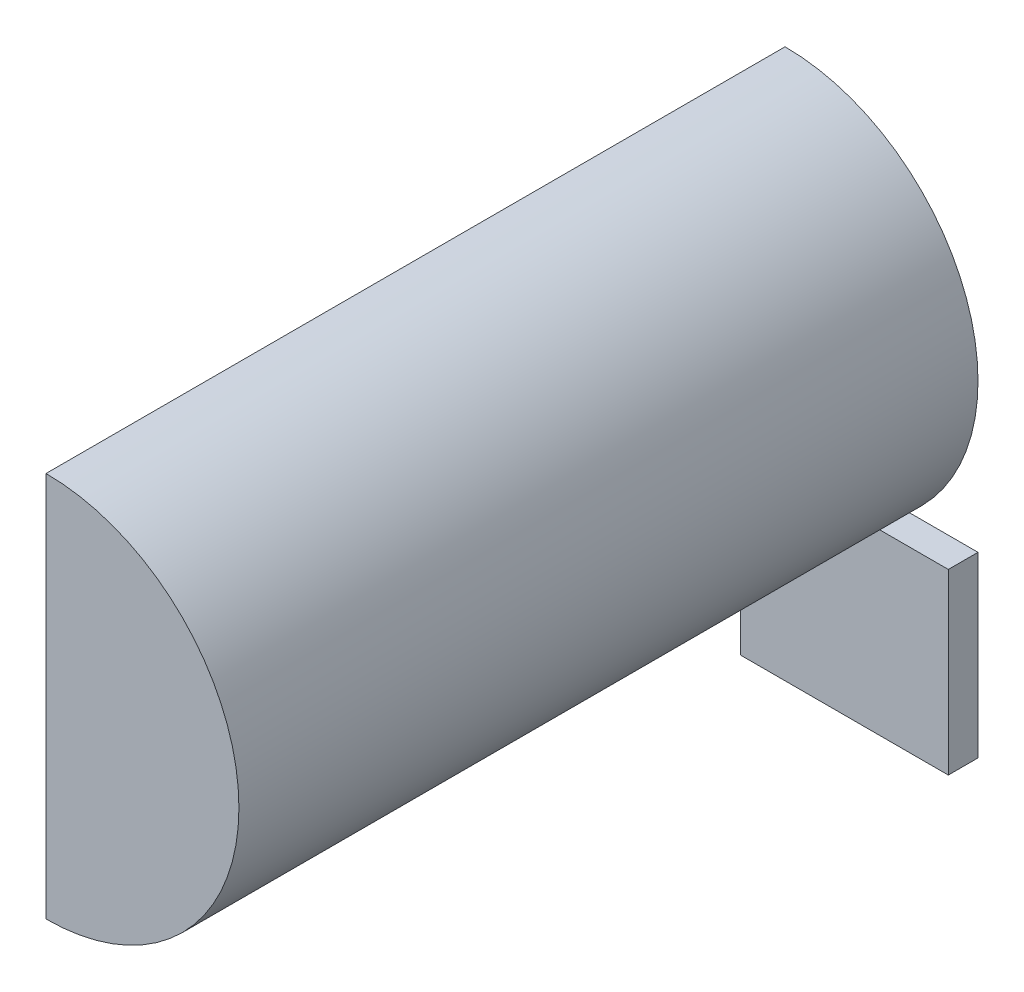
from build123d import *

# Parameters (mm, degrees)
EXTRUDEASSE_DEPTH       = 234
EXTRUDEASSE_DEPTH_BACK  = 15
SKETCH1_R               = 65
SKETCH6_W               = 125.765742684
SKETCH6_H               = 20
CUT_EXTRUDE1_DEPTH      = 10
CUT_EXTRUDE2_DEPTH      = 252.408034876
CUT_EXTRUDE2_DEPTH_BACK = 252.408034876
SKETCH9_W               = 113.781635503
SKETCH9_H               = 478.081574216
SKETCH7_W               = 70
SKETCH7_H               = 10
EXTRPIASTRINA_DEPTH     = 60


with BuildPart() as part:
    # Sketch1 → ExtrudeAsse (new, two sides: drawn at the far end of the back side and taken through both)
    with BuildSketch(Plane.XY.offset(-EXTRUDEASSE_DEPTH_BACK)):
        Circle(SKETCH1_R)
    extrude(amount=EXTRUDEASSE_DEPTH + EXTRUDEASSE_DEPTH_BACK)

    # Sketch6 → Cut-Extrude1 (cut)
    with BuildSketch(Plane(origin=(0, 0, 0), x_dir=(-1, 0, 0), z_dir=(0, 0, -1))):
        with Locations((-8.867505506, -55)):
            Rectangle(SKETCH6_W, SKETCH6_H)
    extrude(amount=CUT_EXTRUDE1_DEPTH, mode=Mode.SUBTRACT)

    # Sketch9 → Cut-Extrude2 (cut, two sides: drawn at the far end of the back side and taken through both)
    with BuildSketch(Plane(origin=(0, 0, 0), x_dir=(1, 0, 0), z_dir=(0, 1, 0)).offset(-CUT_EXTRUDE2_DEPTH_BACK)):
        with Locations((-56.890817752, -139.369631448)):
            Rectangle(SKETCH9_W, SKETCH9_H)
    extrude(amount=CUT_EXTRUDE2_DEPTH + CUT_EXTRUDE2_DEPTH_BACK, mode=Mode.SUBTRACT)


with BuildPart() as body_2:
    # Sketch7 → ExtrPiastrina (new body)
    with BuildSketch(Plane.XZ.offset(45)):
        with Locations((35, -5)):
            Rectangle(SKETCH7_W, SKETCH7_H)
    extrude(amount=EXTRPIASTRINA_DEPTH)


solid = Compound([part.part, body_2.part])
